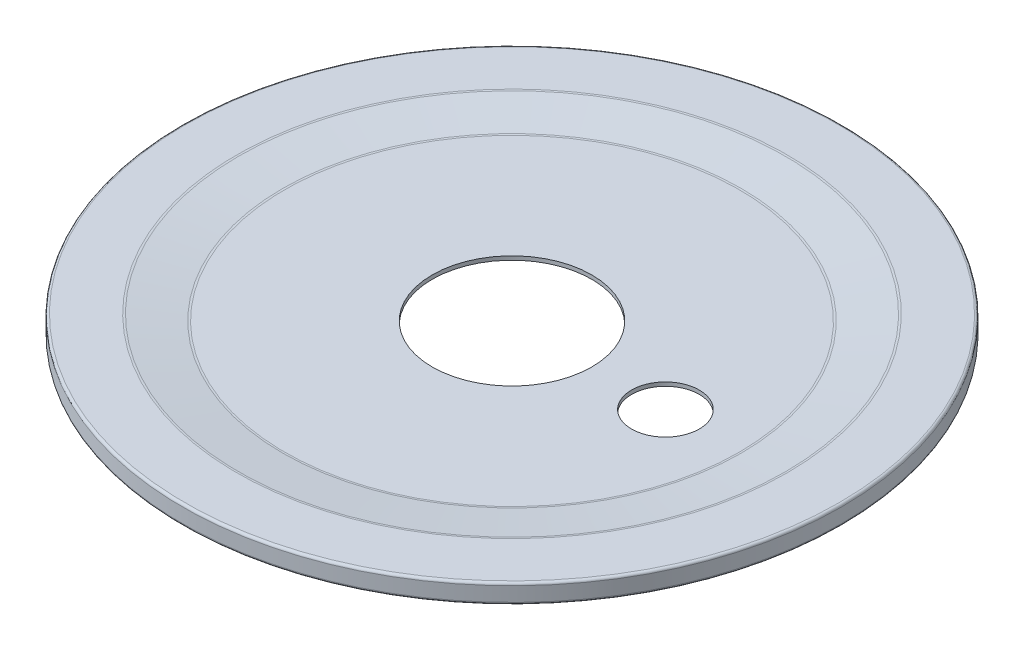
from build123d import *
from OCP.BRepFilletAPI import BRepFilletAPI_MakeFillet

# Parameters (mm, degrees)
FILLET16_R1        = 1.524
FILLET16_R2        = 0.254
SKETCH16839_R      = 3.499999985
CUT_EXTRUDE2_DEPTH = 2.54
SKETCH16838_R      = 8.255
CUT_EXTRUDE3_DEPTH = 2.54


with BuildPart() as part:
    # Sketch7041 → Revolve5 (revolve)
    with BuildSketch(Plane.XY):
        with BuildLine():
            Line((0, 81.50225), (6.35, 81.50225))
            ThreePointArc((6.35, 81.50225), (6.758144984, 81.453958267), (7.14375, 81.31175))
            ThreePointArc((7.14375, 81.31175), (7.529355016, 81.169541733), (7.9375, 81.12125))
            Line((7.9375, 81.12125), (23.6225, 81.12125))
            Line((23.6225, 81.12125), (28.385, 81.75625))
            Line((28.385, 81.75625), (34.1, 81.75625))
            Line((34.1, 81.75625), (34.1, 79.75625))
            Line((34.1, 79.75625), (33.703125, 79.75625))
            Line((33.703125, 79.75625), (33.703125, 81.359375))
            Line((33.703125, 81.359375), (28.411341775, 81.359375))
            Line((28.411341775, 81.359375), (23.648841775, 80.724375))
            Line((23.648841775, 80.724375), (7.9375, 80.724375))
            ThreePointArc((7.9375, 80.724375), (7.436735125, 80.783625522), (6.963625189, 80.958104955))
            ThreePointArc((6.963625189, 80.958104955), (6.665525094, 81.068042057), (6.35, 81.105375))
            Line((6.35, 81.105375), (0, 81.105375))
            Line((0, 81.105375), (0, 81.50225))
        make_face()
    revolve(axis=Axis((0, 82.55, 0), (0, -1, 0)))

    # Fillet16: one fillet with a radius per group of edges: ONE call of the kernel's fillet builder (fillet() takes one radius for all edges)
    fillet16_edges_1 = [part.edges().sort_by_distance(p)[0] for p in [
        (-23.6225, 81.12125, 0),
        (-28.385, 81.75625, 0),
        (-23.648841775, 80.724375, 0),
        (-28.411341775, 81.359375, 0),
    ]]
    fillet16_edges_2 = [part.edges().sort_by_distance(p)[0] for p in [
        (-34.1, 81.75625, 0),
        (-33.703125, 81.359375, 0),
        (-34.1, 79.75625, 0),
    ]]
    fillet16 = BRepFilletAPI_MakeFillet(part.part.solid().wrapped)
    for e in fillet16_edges_1:
        fillet16.Add(FILLET16_R1, e.wrapped)
    for e in fillet16_edges_2:
        fillet16.Add(FILLET16_R2, e.wrapped)
    add(Compound.cast(fillet16.Shape()), mode=Mode.REPLACE)

    # Sketch16839 → Cut-Extrude2 (cut)
    with BuildSketch(Plane(origin=(0, 81.12125, 0), x_dir=(1, 0, 0), z_dir=(0, 1, 0))):
        with Locations((15.875, 0)):
            Circle(SKETCH16839_R)
    extrude(amount=-CUT_EXTRUDE2_DEPTH, mode=Mode.SUBTRACT)

    # Sketch16838 → Cut-Extrude3 (cut)
    with BuildSketch(Plane(origin=(0, 81.50225, 0), x_dir=(1, 0, 0), z_dir=(0, 1, 0))):
        Circle(SKETCH16838_R)
    extrude(amount=-CUT_EXTRUDE3_DEPTH, mode=Mode.SUBTRACT)


with BuildPart() as body_2:
    # Sketch7042 → Revolve6 (revolve)
    with BuildSketch(Plane.XY):
        with BuildLine():
            Line((27.935091775, 81.295875), (33.449125, 81.295875))
            ThreePointArc((33.449125, 81.295875), (33.527819825, 81.268555111), (33.572657423, 81.198349403))
            ThreePointArc((33.572657423, 81.198349403), (33.670396019, 80.647686296), (33.703125, 80.089375))
            Line((33.703125, 80.089375), (33.703125, 81.359375))
            Line((33.703125, 81.359375), (28.411341775, 81.359375))
            Line((28.411341775, 81.359375), (27.935091775, 81.295875))
        make_face()
    revolve(axis=Axis((0, 82.55, 0), (0, -1, 0)))


solid = Compound([part.part, body_2.part])
